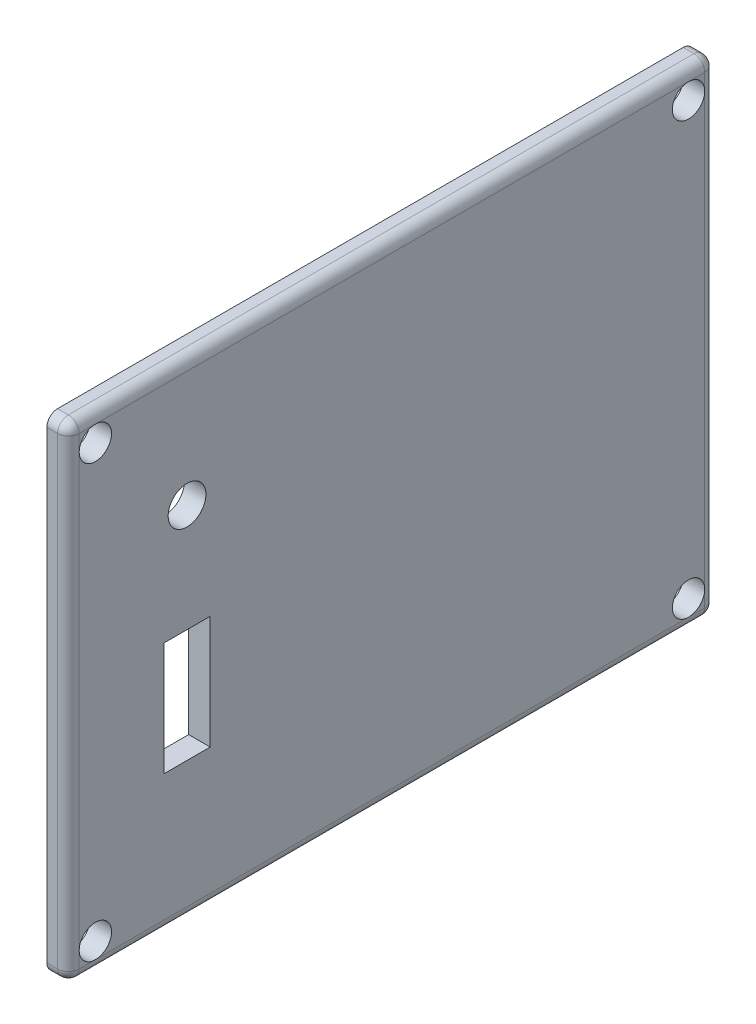
from build123d import *

# Parameters (mm, degrees)
SKETCH1_W                 = 60
SKETCH1_H                 = 45
BOSS_EXTRUDE1_DEPTH       = 2
F_3_0MM_DOWEL_HOLE1_D     = 3
F_3_0MM_DOWEL_HOLE1_DEPTH = 20
F_3_0MM_DOWEL_HOLE1_TIP   = 0.901290929
FILLET2_R                 = 1
FILLET1_R                 = 1
SKETCH4_R                 = 1.75
SKETCH4_W                 = 4.3
SKETCH4_H                 = 10.5
CUT_EXTRUDE1_DEPTH        = 3


with BuildPart() as part:
    # Sketch1 → Boss-Extrude1 (new body)
    with BuildSketch(Plane(origin=(0, 0, 0), x_dir=(0, 0, -1), z_dir=(1, 0, 0))):
        Rectangle(SKETCH1_W, SKETCH1_H)
    extrude(amount=BOSS_EXTRUDE1_DEPTH)

    # Ø3.0mm Dowel Hole1
    with Locations(Plane(origin=(2, 0, 0), x_dir=(0, 0, -1), z_dir=(1, 0, 0))):
        with Locations((-27.5, 20), (27.5, 20), (27.5, -20), (-27.5, -20)):
            Hole(F_3_0MM_DOWEL_HOLE1_D / 2, depth=F_3_0MM_DOWEL_HOLE1_DEPTH)
            with Locations((0, 0, -(F_3_0MM_DOWEL_HOLE1_DEPTH + F_3_0MM_DOWEL_HOLE1_TIP / 2))):  # 118° drill point
                Cone(0, F_3_0MM_DOWEL_HOLE1_D / 2, F_3_0MM_DOWEL_HOLE1_TIP, mode=Mode.SUBTRACT)

    # Fillet2
    fillet2_edges = [part.edges().sort_by_distance(p)[0] for p in [
        (1, -22.5, -30),
        (1, -22.5, 30),
        (1, 22.5, 30),
        (1, 22.5, -30),
    ]]
    fillet(fillet2_edges, radius=FILLET2_R)

    # Fillet1
    fillet1_edges = [part.edges().sort_by_distance(p)[0] for p in [
        (2, 0, -30),
        (2, -22.5, 0),
        (2, 22.5, 0),
        (2, 0, 30),
        (2, 22.207106781, 29.707106781),
        (2, 22.207106781, -29.707106781),
        (2, -22.207106781, 29.707106781),
        (2, -22.207106781, -29.707106781),
    ]]
    fillet(fillet1_edges, radius=FILLET1_R - 0.0001)  # a hair under: the kernel refuses the full size

    # Sketch4 → Cut-Extrude1 (cut)
    with BuildSketch(Plane(origin=(2, 0, 0), x_dir=(0, 0, -1), z_dir=(1, 0, 0))):
        with Locations((-19, 10.75)):
            Circle(SKETCH4_R)
        with Locations((-19, -4.5)):
            Rectangle(SKETCH4_W, SKETCH4_H)
    extrude(amount=-CUT_EXTRUDE1_DEPTH, mode=Mode.SUBTRACT)


solid = part.part
